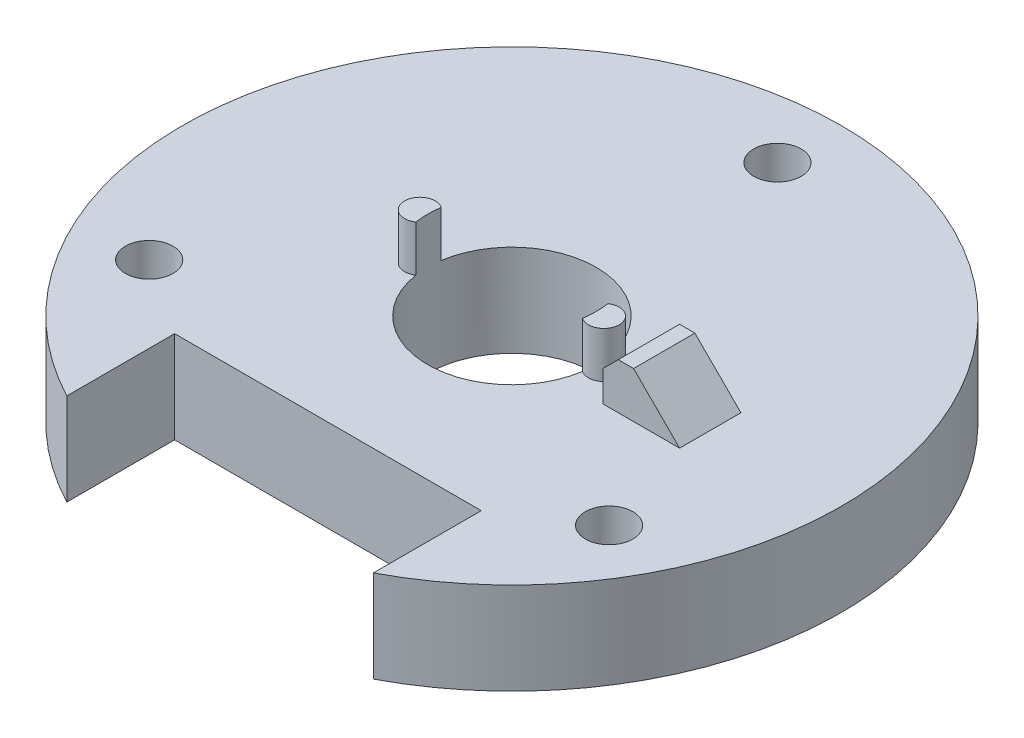
from build123d import *

# Parameters (mm, degrees)
SKETCH1_R           = 21.5
SKETCH1_R_2         = 1.55
BOSS_EXTRUDE1_DEPTH = 6
SKETCH2_R           = 5.5
SKETCH2_W           = 20
SKETCH2_H           = 10
CUT_EXTRUDE1_DEPTH  = 12
BOSS_EXTRUDE2_DEPTH = 3
SKETCH4_W           = 2
SKETCH4_H           = 4
BOSS_EXTRUDE3_DEPTH = 3
CHAMFER1_SIZE       = 1
CHAMFER2_SIZE       = 3


with BuildPart() as part:
    # Sketch1 → Boss-Extrude1 (new body)
    with BuildSketch(Plane(origin=(0, 0, 0), x_dir=(1, 0, 0), z_dir=(0, 1, 0))):
        with Locations(Location((0, 0, 0), (0, 0, 270))):
            Circle(SKETCH1_R)
        with Locations(Location((0, 17.320762114, 0), (0, 0, 270))):
            Circle(SKETCH1_R_2, mode=Mode.SUBTRACT)
        with Locations(Location((15, -8.66, 0), (0, 0, 270))):
            Circle(SKETCH1_R_2, mode=Mode.SUBTRACT)
        with Locations(Location((-15, -8.66, 0), (0, 0, 270))):
            Circle(SKETCH1_R_2, mode=Mode.SUBTRACT)
    extrude(amount=BOSS_EXTRUDE1_DEPTH)

    # Sketch2 → Cut-Extrude1 (cut)
    with BuildSketch(Plane(origin=(0, 0, 0), x_dir=(-1, 0, 0), z_dir=(0, -1, 0))):
        with Locations(Location((0, 0, 0), (0, 0, 90))):
            Circle(SKETCH2_R)
        with Locations((0, -17)):
            Rectangle(SKETCH2_W, SKETCH2_H)
    extrude(amount=-CUT_EXTRUDE1_DEPTH, mode=Mode.SUBTRACT)

    # Sketch3 → Boss-Extrude2 (add)
    with BuildSketch(Plane(origin=(0, 6, 0), x_dir=(1, 0, 0), z_dir=(0, 1, 0))):
        with BuildLine():
            ThreePointArc((-5.4375, 0.826797285), (-7, 0), (-5.4375, -0.826797285))
            ThreePointArc((-5.4375, -0.826797285), (-5.5, 0), (-5.4375, 0.826797285))
        make_face()
        with BuildLine():
            ThreePointArc((5.4375, -0.826797285), (7, 0), (5.4375, 0.826797285))
            ThreePointArc((5.4375, 0.826797285), (5.5, 0), (5.4375, -0.826797285))
        make_face()
    extrude(amount=BOSS_EXTRUDE2_DEPTH)

    # Sketch4 → Boss-Extrude3 (add)
    with BuildSketch(Plane(origin=(0, 6, 0), x_dir=(1, 0, 0), z_dir=(0, 1, 0))):
        with Locations((8.9375, 0)):
            Rectangle(SKETCH4_W, SKETCH4_H)
    extrude(amount=BOSS_EXTRUDE3_DEPTH)

    # Chamfer1
    chamfer1_edges = [part.edges().sort_by_distance(p)[0] for p in [
        (7.9375, 9, 0),
    ]]
    chamfer(chamfer1_edges, length=CHAMFER1_SIZE)

    # Chamfer2
    chamfer2_edges = [part.edges().sort_by_distance(p)[0] for p in [
        (9.9375, 6, 0),
    ]]
    chamfer(chamfer2_edges, length=CHAMFER2_SIZE - 0.0001)  # a hair under: the kernel refuses the full size


solid = part.part
